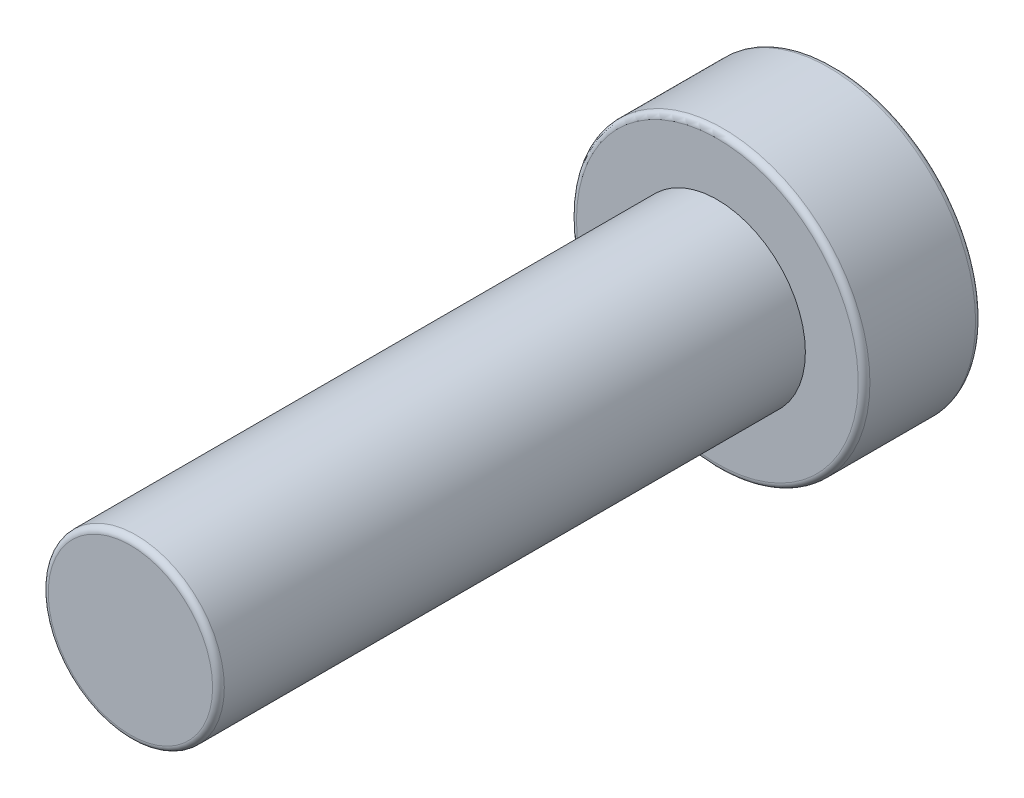
from build123d import *

# Parameters (mm, degrees)
CROQUIS1_R              = 1.5
SALIENTE_EXTRUIR1_DEPTH = 10
CROQUIS3_R              = 2.5
SALIENTE_EXTRUIR3_DEPTH = 2
CORTAR_EXTRUIR1_DEPTH   = 1.5
REDONDEO4_R             = 0.1
REDONDEO5_R             = 0.1
REDONDEO6_R             = 0.1


with BuildPart() as part:
    # Croquis1 → Saliente-Extruir1 (new body)
    with BuildSketch(Plane.XY):
        Circle(CROQUIS1_R)
    extrude(amount=SALIENTE_EXTRUIR1_DEPTH)

    # Croquis3 → Saliente-Extruir3 (add)
    with BuildSketch(Plane(origin=(0, 0, 0), x_dir=(-1, 0, 0), z_dir=(0, 0, -1))):
        Circle(CROQUIS3_R)
    extrude(amount=SALIENTE_EXTRUIR3_DEPTH)

    # Croquis4 → Cortar-Extruir1 (cut)
    with BuildSketch(Plane(origin=(0, 0, -2), x_dir=(-1, 0, 0), z_dir=(0, 0, -1))):
        Polygon((1.5, 0), (0.75, 1.299038106), (-0.75, 1.299038106), (-1.5, 0), (-0.75, -1.299038106), (0.75, -1.299038106), align=None)
    extrude(amount=-CORTAR_EXTRUIR1_DEPTH, mode=Mode.SUBTRACT)

    # Redondeo4
    redondeo4_edges = [part.edges().sort_by_distance(p)[0] for p in [
        (2.5, 0, -2),
    ]]
    fillet(redondeo4_edges, radius=REDONDEO4_R)

    # Redondeo5
    redondeo5_edges = [part.edges().sort_by_distance(p)[0] for p in [
        (2.5, 0, 0),
    ]]
    fillet(redondeo5_edges, radius=REDONDEO5_R)

    # Redondeo6
    redondeo6_edges = [part.edges().sort_by_distance(p)[0] for p in [
        (-1.5, 0, 10),
    ]]
    fillet(redondeo6_edges, radius=REDONDEO6_R)


solid = part.part
